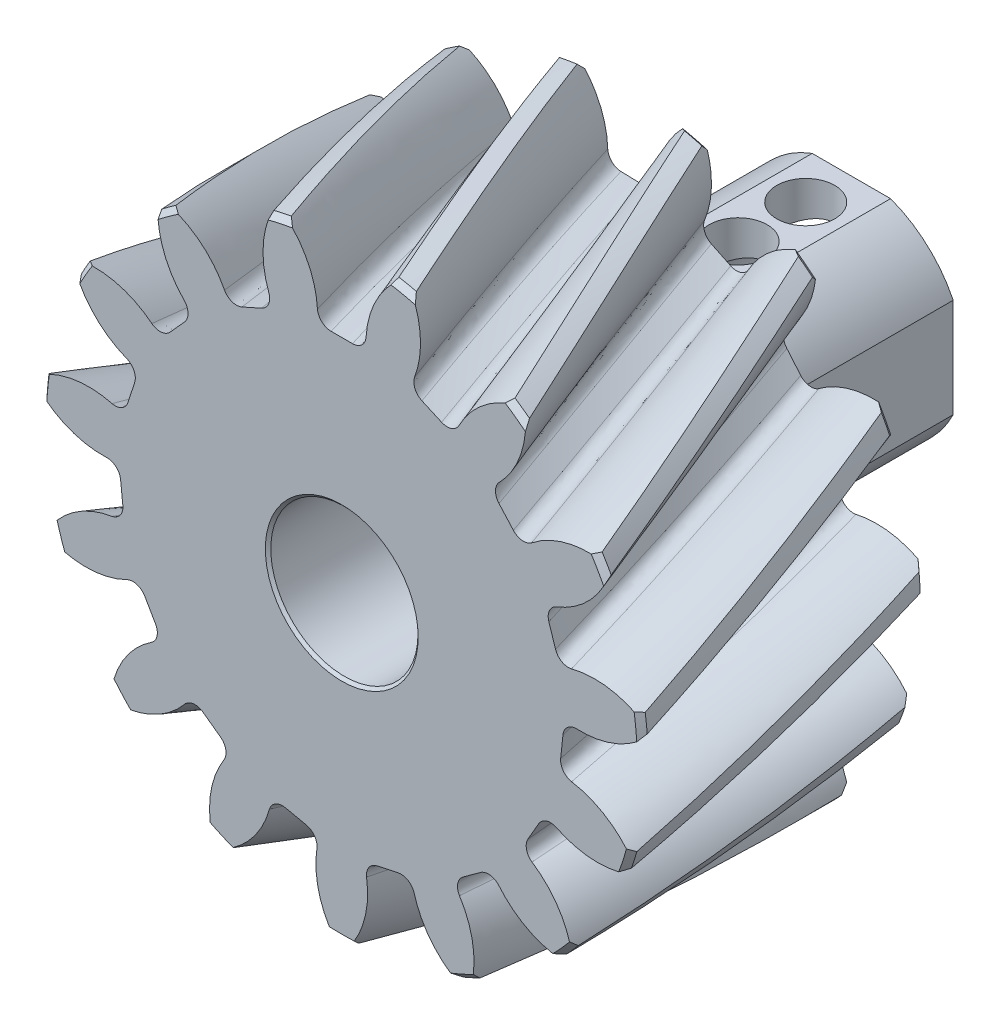
from build123d import *
from OCP.BRepFilletAPI import BRepFilletAPI_MakeChamfer

# Parameters (mm, degrees)
SKETCH2_R           = 10.625
BOSS_EXTRUDE1_DEPTH = 10
M6_TAPPED_HOLE1_D   = 5
CHAMFER2_SIZE       = 0.2
CHAMFER2_SIZE2      = 0.186503017
CUT_SWEEP1_PITCH    = 161.84
SKETCH9_R           = 2.6
CUT_EXTRUDE1_DEPTH  = 10
SKETCH10_W          = 7.19288824
SKETCH10_H          = 7.50537057
BOSS_EXTRUDE2_DEPTH = 8
M2_5_TAPPED_HOLE1_D = 2.05
CUT_EXTRUDE3_START  = -17
SKETCH25_R          = 2.6
CUT_EXTRUDE3_DEPTH  = 17
SKETCH26_R          = 5.813081294
SKETCH26_R_2        = 4
CUT_EXTRUDE4_DEPTH  = 8
CIRPATTERN1_COUNT   = 15


with BuildPart() as part:
    # Sketch2 → Boss-Extrude1 (new body)
    with BuildSketch(Plane.XY):
        Circle(SKETCH2_R)
    extrude(amount=BOSS_EXTRUDE1_DEPTH)

    # M6 Tapped Hole1 (through all)
    with Locations(Plane.XY.offset(10)):
        with Locations((0, 0)):
            Hole(M6_TAPPED_HOLE1_D / 2)

    # Chamfer2: one chamfer whose edges measure the first distance from different faces: ONE call of the kernel's chamfer builder (chamfer() names one face for all edges)
    chamfer2_edges_1 = [part.edges().sort_by_distance(p)[0] for p in [
        (-10.625, 0, 0),
    ]]
    chamfer2_side_1 = [part.faces().sort_by_distance(p)[0] for p in [
        (-10.324479618, 0, 0),
    ]]
    chamfer2_edges_2 = [part.edges().sort_by_distance(p)[0] for p in [
        (-10.625, 0, 10),
    ]]
    chamfer2_side_2 = [part.faces().sort_by_distance(p)[0] for p in [
        (-10.625, 0, 5),
    ]]
    chamfer2_edges_3 = [part.edges().sort_by_distance(p)[0] for p in [
        (2.5, 0, 10),
    ]]
    chamfer2_side_3 = [part.faces().sort_by_distance(p)[0] for p in [
        (-10.324479618, 0, 10),
    ]]
    chamfer2_edges_4 = [part.edges().sort_by_distance(p)[0] for p in [
        (2.5, 0, 0),
    ]]
    chamfer2_side_4 = [part.faces().sort_by_distance(p)[0] for p in [
        (2.5, 0, 5),
    ]]
    chamfer2 = BRepFilletAPI_MakeChamfer(part.part.solid().wrapped)
    for e in chamfer2_edges_1:
        chamfer2.Add(CHAMFER2_SIZE, CHAMFER2_SIZE2, e.wrapped, chamfer2_side_1[0].wrapped)  # the first distance lies on this face
    for e in chamfer2_edges_2:
        chamfer2.Add(CHAMFER2_SIZE, CHAMFER2_SIZE2, e.wrapped, chamfer2_side_2[0].wrapped)  # the first distance lies on this face
    for e in chamfer2_edges_3:
        chamfer2.Add(CHAMFER2_SIZE, CHAMFER2_SIZE2, e.wrapped, chamfer2_side_3[0].wrapped)  # the first distance lies on this face
    for e in chamfer2_edges_4:
        chamfer2.Add(CHAMFER2_SIZE, CHAMFER2_SIZE2, e.wrapped, chamfer2_side_4[0].wrapped)  # the first distance lies on this face
    add(Compound.cast(chamfer2.Shape()), mode=Mode.REPLACE)

    # Cut-Sweep1: the profile of Sketch8 screwed along a left-hand helix of 0.061789 turns, 40 arcs to a turn; built about Z, then put on its axis
    cut_sweep1_z = Axis((0, 0, 0), (0, 0, 1))
    cut_sweep1_corners = [(7.815, -0.38, 0), (7.815, 0.38, 0), (8.25373737, 0.858223165, 0), (10.45373737, 1.9, 0), (10.45373737, -1.9, 0), (8.25373737, -0.858223165, 0)]
    with BuildLine(mode=Mode.PRIVATE) as cut_sweep1_profile:
        Line(cut_sweep1_corners[0], cut_sweep1_corners[1])
        ThreePointArc((7.815, 0.38, 0), (7.941300931, 0.704494944, 0), (8.25373737, 0.858223165, 0))
        ThreePointArc((8.25373737, 0.858223165, 0), (9.454954225, 1.165364191, 0), (10.45373737, 1.9, 0))
        ThreePointArc((10.45373737, 1.9, 0), (10.625, 0, 0), (10.45373737, -1.9, 0))
        ThreePointArc((10.45373737, -1.9, 0), (9.454954225, -1.165364191, 0), (8.25373737, -0.858223165, 0))
        ThreePointArc((8.25373737, -0.858223165, 0), (7.941300931, -0.704494944, 0), (7.815, -0.38, 0))
    cut_sweep1_cap = Face(cut_sweep1_profile.wire())
    cut_sweep1_arcs = [((7.815, 0.38, 0), (7.815, 0.820367496, 0), (8.25373737, 0.858223165, 0), (1, 0.7368730598254759, 1)), ((8.25373737, 0.858223165, 0), (9.564114638, 0.934841779, 0), (10.45373737, 1.9, 0), (1, 0.9272304121920343, 1)), ((10.45373737, 1.9, 0), (10.79906841, 0, 0), (10.45373737, -1.9, 0), (1, 0.9838811642310873, 1)), ((10.45373737, -1.9, 0), (9.564114638, -0.934841779, 0), (8.25373737, -0.858223165, 0), (1, 0.9272304121920337, 1)), ((8.25373737, -0.858223165, 0), (7.815, -0.820367496, 0), (7.815, -0.38, 0), (1, 0.7368730598254759, 1))]  # start, shoulder, end, weights
    cut_sweep1_turn_angles = [0, -4.5, -9, -13.5, -18, -20.122095897, -22.244191794]
    cut_sweep1_turn_weights = [1, 0.996917333733128, 1, 0.996917333733128, 1, 0.9993141879620284, 1]
    cut_sweep1_turn_rails = [Edge.make_bspline([Vector(p[0], p[1], 0).rotate(cut_sweep1_z, cut_sweep1_turn_angles[k]) / cut_sweep1_turn_weights[k] + Vector(0, 0, p[2] + -CUT_SWEEP1_PITCH * cut_sweep1_turn_angles[k] / 360) for k in range(7)], [0, 0, 0, 1, 1, 2, 2, 3, 3, 3], 2, cut_sweep1_turn_weights) for p in cut_sweep1_corners]
    cut_sweep1_turn_sides = [*[Face.make_surface_from_curves(cut_sweep1_turn_rails[p[0]], cut_sweep1_turn_rails[p[1]]) for p in [(0, 1)]], *[Face.make_bezier_surface([[Vector(p[j][0], p[j][1], 0).rotate(cut_sweep1_z, cut_sweep1_turn_angles[2 * i + k]) / cut_sweep1_turn_weights[2 * i + k] + Vector(0, 0, p[j][2] + -CUT_SWEEP1_PITCH * cut_sweep1_turn_angles[2 * i + k] / 360) for k in range(3)] for j in range(3)], [[p[3][j] * cut_sweep1_turn_weights[2 * i + k] for k in range(3)] for j in range(3)]) for p in cut_sweep1_arcs for i in range(3)]]
    cut_sweep1 = Plane(origin=(0, 0, 10), x_dir=(0, 1, 0), z_dir=(0, 0, -1)) * Solid(Shell([*cut_sweep1_turn_sides, cut_sweep1_cap, cut_sweep1_cap.rotate(cut_sweep1_z, -22.244191794).moved(Location((0, 0, -CUT_SWEEP1_PITCH * -22.244191794 / 360)))]))
    add(cut_sweep1, mode=Mode.SUBTRACT)

    # Sketch9 → Cut-Extrude1 (cut)
    with BuildSketch(Plane.XY.offset(10)):
        Circle(SKETCH9_R)
    extrude(amount=-CUT_EXTRUDE1_DEPTH, mode=Mode.SUBTRACT)

    # Sketch10 → Boss-Extrude2 (add)
    with BuildSketch(Plane(origin=(0, 0, 0), x_dir=(-1, 0, 0), z_dir=(0, 0, -1))):
        Rectangle(SKETCH10_W, SKETCH10_H)
    extrude(amount=BOSS_EXTRUDE2_DEPTH)

    # M2.5 Tapped Hole1 (through all)
    with Locations(Plane(origin=(0, 3.752685285, 0), x_dir=(1, 0, 0), z_dir=(0, 1, 0))):
        with Locations((-0.007939256, 6.395800166), (0, 4)):
            Hole(M2_5_TAPPED_HOLE1_D / 2)

    # Sketch25 → Cut-Extrude3 (cut)
    with BuildSketch(Plane(origin=(0, 0, -8), x_dir=(-1, 0, 0), z_dir=(0, 0, -1)).offset(CUT_EXTRUDE3_START)):
        with Locations(Location((0, 0, 0), (0, 0, 180))):
            Circle(SKETCH25_R)
    extrude(amount=CUT_EXTRUDE3_DEPTH, mode=Mode.SUBTRACT)

    # Sketch26 → Cut-Extrude4 (cut)
    with BuildSketch(Plane(origin=(0, 0, -8), x_dir=(-1, 0, 0), z_dir=(0, 0, -1))):
        Circle(SKETCH26_R)
        Circle(SKETCH26_R_2, mode=Mode.SUBTRACT)
    extrude(amount=-CUT_EXTRUDE4_DEPTH, mode=Mode.SUBTRACT)

    # CirPattern1: Cut-Sweep1 ×15 about axis
    cirpattern1_axis = Axis((0, 0, 0), (0, 0, 1))
    for i in range(1, CIRPATTERN1_COUNT):
        add(cut_sweep1.rotate(cirpattern1_axis, i * 360 / CIRPATTERN1_COUNT), mode=Mode.SUBTRACT)


solid = part.part
